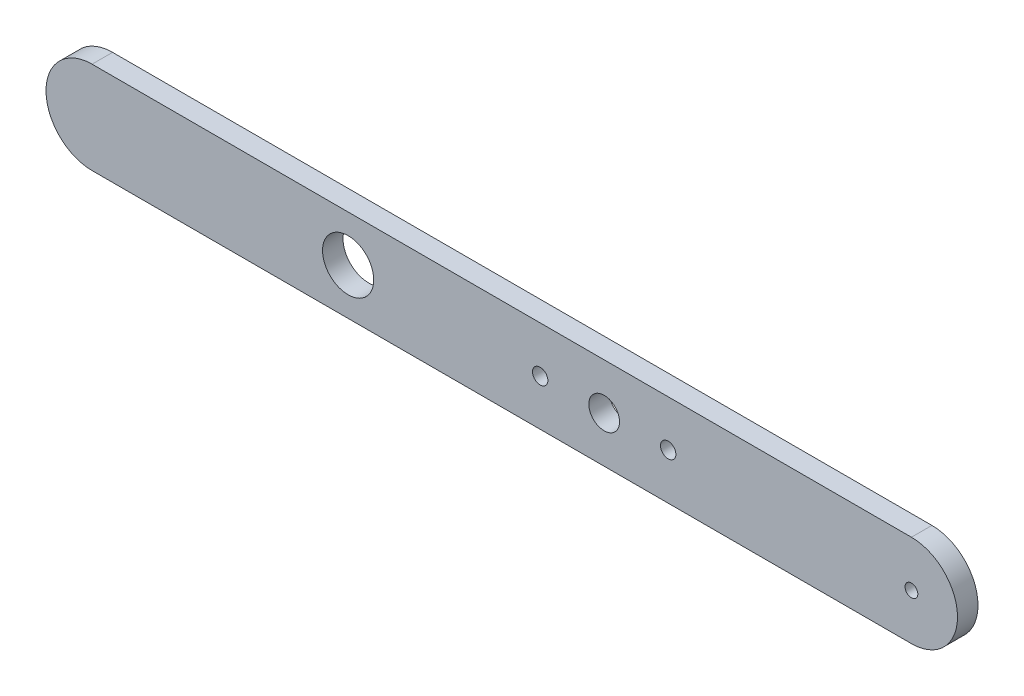
from build123d import *

# Parameters (mm, degrees)
SKETCH_1_R          = 1.25
SKETCH_1_R_2        = 3
SKETCH_1_R_3        = 5
EXTRUDE_1_DEPTH     = 4
SKETCH_2_R          = 1.5
CUT_EXTRUDE_1_DEPTH = 170.286738996


with BuildPart() as part:
    # ｽｹｯﾁ1 → ﾎﾞｽ - 押し出し1 (new body)
    with BuildSketch(Plane.XY):
        with BuildLine():
            Line((0, 9), (160, 9))
            ThreePointArc((160, 9), (169, 0), (160, -9))
            Line((160, -9), (0, -9))
            ThreePointArc((0, -9), (-9, 0), (0, 9))
        make_face()
        with Locations((160, 0)):
            Circle(SKETCH_1_R, mode=Mode.SUBTRACT)
        with Locations((100, 0)):
            Circle(SKETCH_1_R_2, mode=Mode.SUBTRACT)
        with Locations((50, 0)):
            Circle(SKETCH_1_R_3, mode=Mode.SUBTRACT)
    extrude(amount=EXTRUDE_1_DEPTH)

    # ｽｹｯﾁ2 → ｶｯﾄ - 押し出し1 (cut, through all)
    with BuildSketch(Plane.XY.offset(4)):
        with Locations((112.5, 0)):
            Circle(SKETCH_2_R)
        with Locations((87.5, 0)):
            Circle(SKETCH_2_R)
    extrude(amount=-CUT_EXTRUDE_1_DEPTH, mode=Mode.SUBTRACT)


solid = part.part
